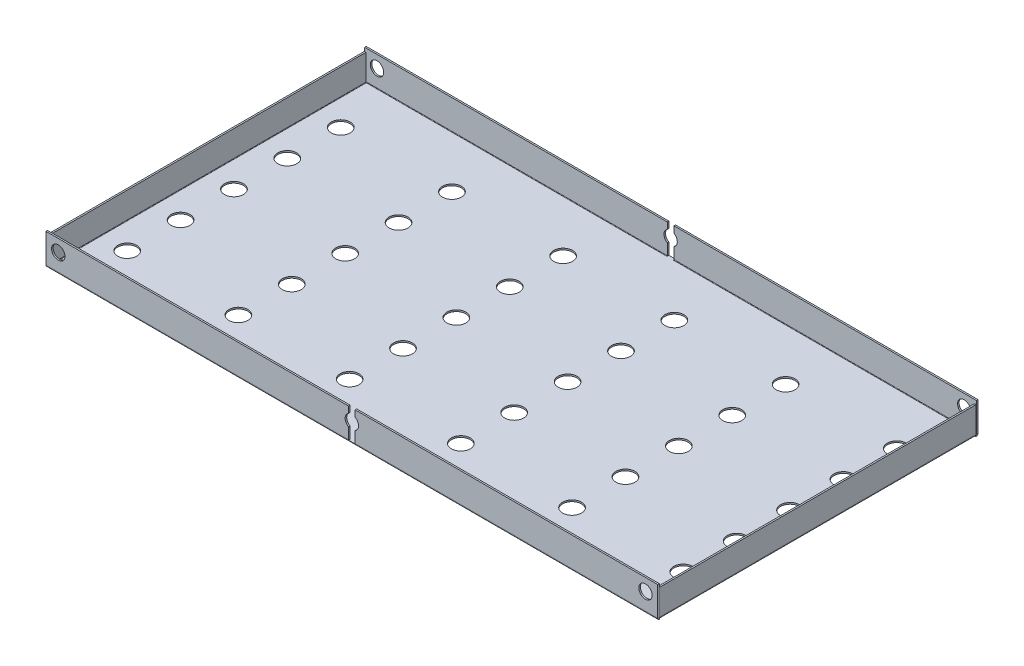
from build123d import *

# Parameters (mm, degrees)
SKETCH_1_W                         = 275
SKETCH_1_H                         = 144
SKETCH_1_R                         = 4.25
SM_BASE_FLANGE_1_DEPTH             = 0.7
SM_EDGE_FLANGE_1_STRIP_W           = 3.2
SM_EDGE_FLANGE_1_STRIP_H           = 0.7
SM_EDGE_FLANGE_1_STRIP_CUT_DEPTH   = 275
SM_EDGE_FLANGE_1_STRIP_2_W         = 3.2
SM_EDGE_FLANGE_1_STRIP_2_H         = 0.7
SM_EDGE_FLANGE_1_STRIP_CUT_2_DEPTH = 275
SM_EDGE_FLANGE_1_DEPTH             = 275
SM_EDGE_FLANGE_1_BEND_DEPTH        = 275
SKETCH_14_R                        = 3
CUT_EXTRUDE_1_DEPTH                = 10
SKETCH_15_R                        = 3
CUT_EXTRUDE_2_DEPTH                = 10
SKETCH_16_W                        = 3
SKETCH_16_H                        = 13.3
CUT_EXTRUDE_3_DEPTH                = 10
SKETCH_17_W                        = 3
SKETCH_17_H                        = 13.3
CUT_EXTRUDE_4_DEPTH                = 10
SM_EDGE_FLANGE_2_STRIP_W           = 3.2
SM_EDGE_FLANGE_2_STRIP_H           = 0.7
SM_EDGE_FLANGE_2_STRIP_CUT_DEPTH   = 142.2
SM_EDGE_FLANGE_2_STRIP_2_W         = 3.2
SM_EDGE_FLANGE_2_STRIP_2_H         = 0.7
SM_EDGE_FLANGE_2_STRIP_CUT_2_DEPTH = 142.2
SM_EDGE_FLANGE_2_DEPTH             = 142.2
SM_EDGE_FLANGE_2_BEND_DEPTH        = 142.2


# Sheet-metal steps are written as plain solids
with BuildPart() as part:
    # Sketch 1 → 基体-法兰1 (new body)
    with BuildSketch(Plane(origin=(0, 0, 0), x_dir=(1, 0, 0), z_dir=(0, 1, 0))):
        Rectangle(SKETCH_1_W, SKETCH_1_H)
        with Locations(Location((-125, -48, 0), (0, 0, 270))):
            Circle(SKETCH_1_R, mode=Mode.SUBTRACT)
        with Locations(Location((-125, -24, 0), (0, 0, 270))):
            Circle(SKETCH_1_R, mode=Mode.SUBTRACT)
        with Locations(Location((-125, 0, 0), (0, 0, 270))):
            Circle(SKETCH_1_R, mode=Mode.SUBTRACT)
        with Locations(Location((-125, 24, 0), (0, 0, 270))):
            Circle(SKETCH_1_R, mode=Mode.SUBTRACT)
        with Locations(Location((-125, 48, 0), (0, 0, 270))):
            Circle(SKETCH_1_R, mode=Mode.SUBTRACT)
        with Locations(Location((-75, -48, 0), (0, 0, 90))):
            Circle(SKETCH_1_R, mode=Mode.SUBTRACT)
        with Locations(Location((-75, -24, 0), (0, 0, 90))):
            Circle(SKETCH_1_R, mode=Mode.SUBTRACT)
        with Locations(Location((-75, 0, 0), (0, 0, 90))):
            Circle(SKETCH_1_R, mode=Mode.SUBTRACT)
        with Locations(Location((-75, 24, 0), (0, 0, 90))):
            Circle(SKETCH_1_R, mode=Mode.SUBTRACT)
        with Locations(Location((-75, 48, 0), (0, 0, 90))):
            Circle(SKETCH_1_R, mode=Mode.SUBTRACT)
        with Locations(Location((-25, -48, 0), (0, 0, 270))):
            Circle(SKETCH_1_R, mode=Mode.SUBTRACT)
        with Locations(Location((-25, -24, 0), (0, 0, 270))):
            Circle(SKETCH_1_R, mode=Mode.SUBTRACT)
        with Locations(Location((-25, 0, 0), (0, 0, 270))):
            Circle(SKETCH_1_R, mode=Mode.SUBTRACT)
        with Locations(Location((-25, 24, 0), (0, 0, 270))):
            Circle(SKETCH_1_R, mode=Mode.SUBTRACT)
        with Locations(Location((-25, 48, 0), (0, 0, 270))):
            Circle(SKETCH_1_R, mode=Mode.SUBTRACT)
        with Locations(Location((25, -48, 0), (0, 0, 90))):
            Circle(SKETCH_1_R, mode=Mode.SUBTRACT)
        with Locations(Location((25, -24, 0), (0, 0, 90))):
            Circle(SKETCH_1_R, mode=Mode.SUBTRACT)
        with Locations(Location((25, 0, 0), (0, 0, 90))):
            Circle(SKETCH_1_R, mode=Mode.SUBTRACT)
        with Locations(Location((25, 24, 0), (0, 0, 90))):
            Circle(SKETCH_1_R, mode=Mode.SUBTRACT)
        with Locations(Location((25, 48, 0), (0, 0, 90))):
            Circle(SKETCH_1_R, mode=Mode.SUBTRACT)
        with Locations(Location((75, 48, 0), (0, 0, 270))):
            Circle(SKETCH_1_R, mode=Mode.SUBTRACT)
        with Locations(Location((75, 24, 0), (0, 0, 270))):
            Circle(SKETCH_1_R, mode=Mode.SUBTRACT)
        with Locations(Location((75, 0, 0), (0, 0, 270))):
            Circle(SKETCH_1_R, mode=Mode.SUBTRACT)
        with Locations(Location((75, -24, 0), (0, 0, 270))):
            Circle(SKETCH_1_R, mode=Mode.SUBTRACT)
        with Locations(Location((75, -48, 0), (0, 0, 270))):
            Circle(SKETCH_1_R, mode=Mode.SUBTRACT)
        with Locations(Location((125, -48, 0), (0, 0, 90))):
            Circle(SKETCH_1_R, mode=Mode.SUBTRACT)
        with Locations(Location((125, -24, 0), (0, 0, 90))):
            Circle(SKETCH_1_R, mode=Mode.SUBTRACT)
        with Locations(Location((125, 0, 0), (0, 0, 90))):
            Circle(SKETCH_1_R, mode=Mode.SUBTRACT)
        with Locations(Location((125, 24, 0), (0, 0, 90))):
            Circle(SKETCH_1_R, mode=Mode.SUBTRACT)
        with Locations(Location((125, 48, 0), (0, 0, 90))):
            Circle(SKETCH_1_R, mode=Mode.SUBTRACT)
    extrude(amount=-SM_BASE_FLANGE_1_DEPTH)

    # 边线-法兰1 strip (across the edge) → 边线-法兰1 strip cut (cut)
    with BuildSketch(Plane(origin=(-137.5, 0, 72), x_dir=(0, 0, -1), z_dir=(1, 0, 0))):
        with Locations((-0.7, -0.35)):
            Rectangle(SM_EDGE_FLANGE_1_STRIP_W, SM_EDGE_FLANGE_1_STRIP_H)
    extrude(amount=SM_EDGE_FLANGE_1_STRIP_CUT_DEPTH, mode=Mode.SUBTRACT)

    # 边线-法兰1 strip 2 (across the edge) → 边线-法兰1 strip cut 2 (cut)
    with BuildSketch(Plane(origin=(137.5, 0, -72), x_dir=(0, 0, 1), z_dir=(-1, 0, 0))):
        with Locations((-0.7, -0.35)):
            Rectangle(SM_EDGE_FLANGE_1_STRIP_2_W, SM_EDGE_FLANGE_1_STRIP_2_H)
    extrude(amount=SM_EDGE_FLANGE_1_STRIP_CUT_2_DEPTH, mode=Mode.SUBTRACT)

    # 边线-法兰1 section (across the edge) → 边线-法兰1 (add)
    with BuildSketch(Plane(origin=(-137.5, 0, 72), x_dir=(0, 0, -1), z_dir=(1, 0, 0))):
        with BuildLine():
            Line((0, 0.2), (0, 13.3))
            Line((0, 13.3), (0.7, 13.3))
            Line((0.7, 13.3), (0.7, 0.2))
            ThreePointArc((0.7, 0.2), (0.758578644, 0.058578644), (0.9, 0))
            Line((0.9, 0), (0.9, -0.7))
            ThreePointArc((0.9, -0.7), (0.263603897, -0.436396103), (0, 0.2))
        make_face()
    extrude(amount=SM_EDGE_FLANGE_1_DEPTH)

    # 边线-法兰1 section 2 (across the edge) → 边线-法兰1 bend (add)
    with BuildSketch(Plane(origin=(137.5, 0, -72), x_dir=(0, 0, 1), z_dir=(-1, 0, 0))):
        with BuildLine():
            Line((0, 0.2), (0, 13.3))
            Line((0, 13.3), (0.7, 13.3))
            Line((0.7, 13.3), (0.7, 0.2))
            ThreePointArc((0.7, 0.2), (0.758578644, 0.058578644), (0.9, 0))
            Line((0.9, 0), (0.9, -0.7))
            ThreePointArc((0.9, -0.7), (0.263603897, -0.436396103), (0, 0.2))
        make_face()
    extrude(amount=SM_EDGE_FLANGE_1_BEND_DEPTH)

    # 草图14 → 切除-拉伸1 (cut)
    with BuildSketch(Plane(origin=(0, 0, 71.3), x_dir=(-1, 0, 0), z_dir=(0, 0, -1))):
        with Locations((-132, 7.8)):
            Circle(SKETCH_14_R)
        with Locations((0, 7.8)):
            Circle(SKETCH_14_R)
        with Locations((132, 7.8)):
            Circle(SKETCH_14_R)
    extrude(amount=-CUT_EXTRUDE_1_DEPTH, mode=Mode.SUBTRACT)

    # 草图15 → 切除-拉伸2 (cut)
    with BuildSketch(Plane(origin=(0, 0, -72), x_dir=(-1, 0, 0), z_dir=(0, 0, -1))):
        with Locations((-132, 7.8)):
            Circle(SKETCH_15_R)
        with Locations((0, 7.8)):
            Circle(SKETCH_15_R)
        with Locations((132, 7.8)):
            Circle(SKETCH_15_R)
    extrude(amount=-CUT_EXTRUDE_2_DEPTH, mode=Mode.SUBTRACT)

    # 草图16 → 切除-拉伸3 (cut)
    with BuildSketch(Plane(origin=(0, 0, -72), x_dir=(-1, 0, 0), z_dir=(0, 0, -1))):
        with Locations((0, 6.65)):
            Rectangle(SKETCH_16_W, SKETCH_16_H)
    extrude(amount=-CUT_EXTRUDE_3_DEPTH, mode=Mode.SUBTRACT)

    # 草图17 → 切除-拉伸4 (cut)
    with BuildSketch(Plane.XY.offset(72)):
        with Locations((0, 6.65)):
            Rectangle(SKETCH_17_W, SKETCH_17_H)
    extrude(amount=-CUT_EXTRUDE_4_DEPTH, mode=Mode.SUBTRACT)

    # 边线-法兰2 strip (across the edge) → 边线-法兰2 strip cut (cut)
    with BuildSketch(Plane(origin=(-137.5, 0, -71.1), x_dir=(1, 0, 0), z_dir=(0, 0, 1))):
        with Locations((-0.7, -0.35)):
            Rectangle(SM_EDGE_FLANGE_2_STRIP_W, SM_EDGE_FLANGE_2_STRIP_H)
    extrude(amount=SM_EDGE_FLANGE_2_STRIP_CUT_DEPTH, mode=Mode.SUBTRACT)

    # 边线-法兰2 strip 2 (across the edge) → 边线-法兰2 strip cut 2 (cut)
    with BuildSketch(Plane(origin=(137.5, 0, 71.1), x_dir=(-1, 0, 0), z_dir=(0, 0, -1))):
        with Locations((-0.7, -0.35)):
            Rectangle(SM_EDGE_FLANGE_2_STRIP_2_W, SM_EDGE_FLANGE_2_STRIP_2_H)
    extrude(amount=SM_EDGE_FLANGE_2_STRIP_CUT_2_DEPTH, mode=Mode.SUBTRACT)

    # 边线-法兰2 section (across the edge) → 边线-法兰2 (add)
    with BuildSketch(Plane(origin=(-137.5, 0, -71.1), x_dir=(1, 0, 0), z_dir=(0, 0, 1))):
        with BuildLine():
            Line((0, 0.2), (0, 11.8))
            Line((0, 11.8), (0.7, 11.8))
            Line((0.7, 11.8), (0.7, 0.2))
            ThreePointArc((0.7, 0.2), (0.758578644, 0.058578644), (0.9, 0))
            Line((0.9, 0), (0.9, -0.7))
            ThreePointArc((0.9, -0.7), (0.263603897, -0.436396103), (0, 0.2))
        make_face()
    extrude(amount=SM_EDGE_FLANGE_2_DEPTH)

    # 边线-法兰2 section 2 (across the edge) → 边线-法兰2 bend (add)
    with BuildSketch(Plane(origin=(137.5, 0, 71.1), x_dir=(-1, 0, 0), z_dir=(0, 0, -1))):
        with BuildLine():
            Line((0, 0.2), (0, 11.8))
            Line((0, 11.8), (0.7, 11.8))
            Line((0.7, 11.8), (0.7, 0.2))
            ThreePointArc((0.7, 0.2), (0.758578644, 0.058578644), (0.9, 0))
            Line((0.9, 0), (0.9, -0.7))
            ThreePointArc((0.9, -0.7), (0.263603897, -0.436396103), (0, 0.2))
        make_face()
    extrude(amount=SM_EDGE_FLANGE_2_BEND_DEPTH)


solid = part.part
